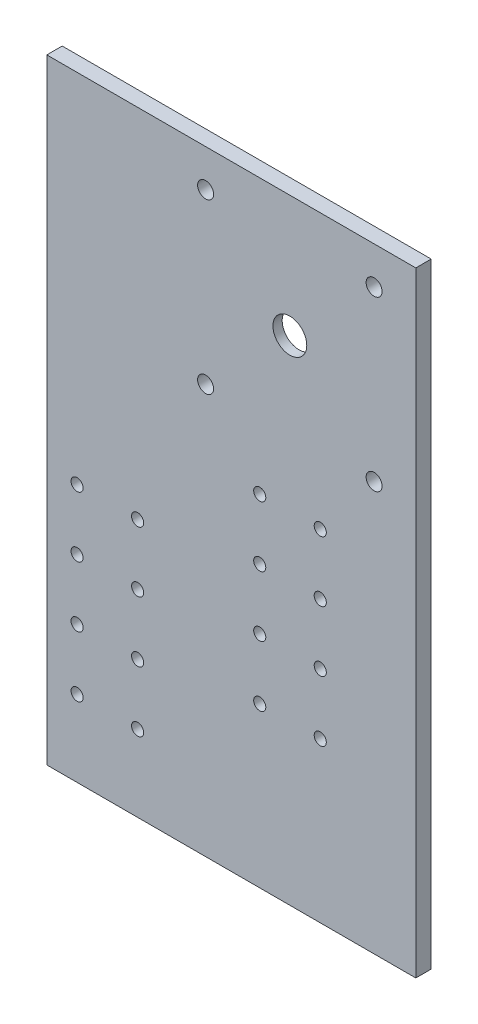
from build123d import *

# Parameters (mm, degrees)
SKETCH1_W           = 152.4
SKETCH1_H           = 254
BOSS_EXTRUDE1_DEPTH = 6.35
CUT_EXTRUDE1_REACH  = 150.242
SKETCH2_R           = 3.302
CUT_EXTRUDE2_REACH  = 150.242
SKETCH3_R           = 2.5
SKETCH4_R           = 36.5125
CUT_EXTRUDE3_DEPTH  = 2.54
CUT_EXTRUDE4_REACH  = 150.242
SKETCH6_R           = 6.985


with BuildPart() as part:
    # Sketch1 → Boss-Extrude1 (new body)
    with BuildSketch(Plane.XY):
        Rectangle(SKETCH1_W, SKETCH1_H)
    extrude(amount=BOSS_EXTRUDE1_DEPTH)

    # Sketch2 → Cut-Extrude1 (cut, up to next)
    with BuildSketch(Plane.XY.offset(6.35), mode=Mode.PRIVATE) as cut_extrude1_sk1:
        with Locations((58.978992443, 111.560894882)):
            Circle(SKETCH2_R)
    cut_extrude1_tool1 = extrude(cut_extrude1_sk1.sketch, amount=-CUT_EXTRUDE1_REACH, mode=Mode.PRIVATE) & part.part
    # Sketch2 → Cut-Extrude1 (cut, up to next)
    with BuildSketch(Plane.XY.offset(6.35), mode=Mode.PRIVATE) as cut_extrude1_sk2:
        with Locations((-10.617007564, 111.560894882)):
            Circle(SKETCH2_R)
    cut_extrude1_tool2 = extrude(cut_extrude1_sk2.sketch, amount=-CUT_EXTRUDE1_REACH, mode=Mode.PRIVATE) & part.part
    # Sketch2 → Cut-Extrude1 (cut, up to next)
    with BuildSketch(Plane.XY.offset(6.35), mode=Mode.PRIVATE) as cut_extrude1_sk3:
        with Locations((58.979977353, 41.964894882)):
            Circle(SKETCH2_R)
    cut_extrude1_tool3 = extrude(cut_extrude1_sk3.sketch, amount=-CUT_EXTRUDE1_REACH, mode=Mode.PRIVATE) & part.part
    # Sketch2 → Cut-Extrude1 (cut, up to next)
    with BuildSketch(Plane.XY.offset(6.35), mode=Mode.PRIVATE) as cut_extrude1_sk4:
        with Locations((-10.617992519, 41.963909921)):
            Circle(SKETCH2_R)
    cut_extrude1_tool4 = extrude(cut_extrude1_sk4.sketch, amount=-CUT_EXTRUDE1_REACH, mode=Mode.PRIVATE) & part.part
    add(cut_extrude1_tool1.solids().sort_by_distance((58.978992, 111.560895, 6.35))[0], mode=Mode.SUBTRACT)
    add(cut_extrude1_tool2.solids().sort_by_distance((-10.617008, 111.560895, 6.35))[0], mode=Mode.SUBTRACT)
    add(cut_extrude1_tool3.solids().sort_by_distance((58.979977, 41.964895, 6.35))[0], mode=Mode.SUBTRACT)
    add(cut_extrude1_tool4.solids().sort_by_distance((-10.617993, 41.96391, 6.35))[0], mode=Mode.SUBTRACT)

    # Sketch3 → Cut-Extrude2 (cut, up to next)
    with BuildSketch(Plane(origin=(0, 0, 0), x_dir=(-1, 0, 0), z_dir=(0, 0, -1)), mode=Mode.PRIVATE) as cut_extrude2_sk1:
        with Locations((63.7, -20.45)):
            Circle(SKETCH3_R)
    cut_extrude2_tool1 = extrude(cut_extrude2_sk1.sketch, amount=-CUT_EXTRUDE2_REACH, mode=Mode.PRIVATE) & part.part
    # Sketch3 → Cut-Extrude2 (cut, up to next)
    with BuildSketch(Plane(origin=(0, 0, 0), x_dir=(-1, 0, 0), z_dir=(0, 0, -1)), mode=Mode.PRIVATE) as cut_extrude2_sk2:
        with Locations((38.7, -20.45)):
            Circle(SKETCH3_R)
    cut_extrude2_tool2 = extrude(cut_extrude2_sk2.sketch, amount=-CUT_EXTRUDE2_REACH, mode=Mode.PRIVATE) & part.part
    # Sketch3 → Cut-Extrude2 (cut, up to next)
    with BuildSketch(Plane(origin=(0, 0, 0), x_dir=(-1, 0, 0), z_dir=(0, 0, -1)), mode=Mode.PRIVATE) as cut_extrude2_sk3:
        with Locations((38.7, -45.45)):
            Circle(SKETCH3_R)
    cut_extrude2_tool3 = extrude(cut_extrude2_sk3.sketch, amount=-CUT_EXTRUDE2_REACH, mode=Mode.PRIVATE) & part.part
    # Sketch3 → Cut-Extrude2 (cut, up to next)
    with BuildSketch(Plane(origin=(0, 0, 0), x_dir=(-1, 0, 0), z_dir=(0, 0, -1)), mode=Mode.PRIVATE) as cut_extrude2_sk4:
        with Locations((63.7, -45.45)):
            Circle(SKETCH3_R)
    cut_extrude2_tool4 = extrude(cut_extrude2_sk4.sketch, amount=-CUT_EXTRUDE2_REACH, mode=Mode.PRIVATE) & part.part
    # Sketch3 → Cut-Extrude2 (cut, up to next)
    with BuildSketch(Plane(origin=(0, 0, 0), x_dir=(-1, 0, 0), z_dir=(0, 0, -1)), mode=Mode.PRIVATE) as cut_extrude2_sk5:
        with Locations((63.7, -70.45)):
            Circle(SKETCH3_R)
    cut_extrude2_tool5 = extrude(cut_extrude2_sk5.sketch, amount=-CUT_EXTRUDE2_REACH, mode=Mode.PRIVATE) & part.part
    # Sketch3 → Cut-Extrude2 (cut, up to next)
    with BuildSketch(Plane(origin=(0, 0, 0), x_dir=(-1, 0, 0), z_dir=(0, 0, -1)), mode=Mode.PRIVATE) as cut_extrude2_sk6:
        with Locations((38.7, -70.45)):
            Circle(SKETCH3_R)
    cut_extrude2_tool6 = extrude(cut_extrude2_sk6.sketch, amount=-CUT_EXTRUDE2_REACH, mode=Mode.PRIVATE) & part.part
    # Sketch3 → Cut-Extrude2 (cut, up to next)
    with BuildSketch(Plane(origin=(0, 0, 0), x_dir=(-1, 0, 0), z_dir=(0, 0, -1)), mode=Mode.PRIVATE) as cut_extrude2_sk7:
        with Locations((38.7, -95.45)):
            Circle(SKETCH3_R)
    cut_extrude2_tool7 = extrude(cut_extrude2_sk7.sketch, amount=-CUT_EXTRUDE2_REACH, mode=Mode.PRIVATE) & part.part
    # Sketch3 → Cut-Extrude2 (cut, up to next)
    with BuildSketch(Plane(origin=(0, 0, 0), x_dir=(-1, 0, 0), z_dir=(0, 0, -1)), mode=Mode.PRIVATE) as cut_extrude2_sk8:
        with Locations((63.7, -95.45)):
            Circle(SKETCH3_R)
    cut_extrude2_tool8 = extrude(cut_extrude2_sk8.sketch, amount=-CUT_EXTRUDE2_REACH, mode=Mode.PRIVATE) & part.part
    # Sketch3 → Cut-Extrude2 (cut, up to next)
    with BuildSketch(Plane(origin=(0, 0, 0), x_dir=(-1, 0, 0), z_dir=(0, 0, -1)), mode=Mode.PRIVATE) as cut_extrude2_sk9:
        with Locations((-11.738, -61.16)):
            Circle(SKETCH3_R)
    cut_extrude2_tool9 = extrude(cut_extrude2_sk9.sketch, amount=-CUT_EXTRUDE2_REACH, mode=Mode.PRIVATE) & part.part
    # Sketch3 → Cut-Extrude2 (cut, up to next)
    with BuildSketch(Plane(origin=(0, 0, 0), x_dir=(-1, 0, 0), z_dir=(0, 0, -1)), mode=Mode.PRIVATE) as cut_extrude2_sk10:
        with Locations((-11.738, -36.16)):
            Circle(SKETCH3_R)
    cut_extrude2_tool10 = extrude(cut_extrude2_sk10.sketch, amount=-CUT_EXTRUDE2_REACH, mode=Mode.PRIVATE) & part.part
    # Sketch3 → Cut-Extrude2 (cut, up to next)
    with BuildSketch(Plane(origin=(0, 0, 0), x_dir=(-1, 0, 0), z_dir=(0, 0, -1)), mode=Mode.PRIVATE) as cut_extrude2_sk11:
        with Locations((-36.738, -61.16)):
            Circle(SKETCH3_R)
    cut_extrude2_tool11 = extrude(cut_extrude2_sk11.sketch, amount=-CUT_EXTRUDE2_REACH, mode=Mode.PRIVATE) & part.part
    # Sketch3 → Cut-Extrude2 (cut, up to next)
    with BuildSketch(Plane(origin=(0, 0, 0), x_dir=(-1, 0, 0), z_dir=(0, 0, -1)), mode=Mode.PRIVATE) as cut_extrude2_sk12:
        with Locations((-36.738, -36.16)):
            Circle(SKETCH3_R)
    cut_extrude2_tool12 = extrude(cut_extrude2_sk12.sketch, amount=-CUT_EXTRUDE2_REACH, mode=Mode.PRIVATE) & part.part
    # Sketch3 → Cut-Extrude2 (cut, up to next)
    with BuildSketch(Plane(origin=(0, 0, 0), x_dir=(-1, 0, 0), z_dir=(0, 0, -1)), mode=Mode.PRIVATE) as cut_extrude2_sk13:
        with Locations((-11.738, -11.16)):
            Circle(SKETCH3_R)
    cut_extrude2_tool13 = extrude(cut_extrude2_sk13.sketch, amount=-CUT_EXTRUDE2_REACH, mode=Mode.PRIVATE) & part.part
    # Sketch3 → Cut-Extrude2 (cut, up to next)
    with BuildSketch(Plane(origin=(0, 0, 0), x_dir=(-1, 0, 0), z_dir=(0, 0, -1)), mode=Mode.PRIVATE) as cut_extrude2_sk14:
        with Locations((-36.738, -11.16)):
            Circle(SKETCH3_R)
    cut_extrude2_tool14 = extrude(cut_extrude2_sk14.sketch, amount=-CUT_EXTRUDE2_REACH, mode=Mode.PRIVATE) & part.part
    # Sketch3 → Cut-Extrude2 (cut, up to next)
    with BuildSketch(Plane(origin=(0, 0, 0), x_dir=(-1, 0, 0), z_dir=(0, 0, -1)), mode=Mode.PRIVATE) as cut_extrude2_sk15:
        with Locations((-36.738, 13.84)):
            Circle(SKETCH3_R)
    cut_extrude2_tool15 = extrude(cut_extrude2_sk15.sketch, amount=-CUT_EXTRUDE2_REACH, mode=Mode.PRIVATE) & part.part
    # Sketch3 → Cut-Extrude2 (cut, up to next)
    with BuildSketch(Plane(origin=(0, 0, 0), x_dir=(-1, 0, 0), z_dir=(0, 0, -1)), mode=Mode.PRIVATE) as cut_extrude2_sk16:
        with Locations((-11.738, 13.84)):
            Circle(SKETCH3_R)
    cut_extrude2_tool16 = extrude(cut_extrude2_sk16.sketch, amount=-CUT_EXTRUDE2_REACH, mode=Mode.PRIVATE) & part.part
    add(cut_extrude2_tool1.solids().sort_by_distance((-63.7, -20.45, 0))[0], mode=Mode.SUBTRACT)
    add(cut_extrude2_tool2.solids().sort_by_distance((-38.7, -20.45, 0))[0], mode=Mode.SUBTRACT)
    add(cut_extrude2_tool3.solids().sort_by_distance((-38.7, -45.45, 0))[0], mode=Mode.SUBTRACT)
    add(cut_extrude2_tool4.solids().sort_by_distance((-63.7, -45.45, 0))[0], mode=Mode.SUBTRACT)
    add(cut_extrude2_tool5.solids().sort_by_distance((-63.7, -70.45, 0))[0], mode=Mode.SUBTRACT)
    add(cut_extrude2_tool6.solids().sort_by_distance((-38.7, -70.45, 0))[0], mode=Mode.SUBTRACT)
    add(cut_extrude2_tool7.solids().sort_by_distance((-38.7, -95.45, 0))[0], mode=Mode.SUBTRACT)
    add(cut_extrude2_tool8.solids().sort_by_distance((-63.7, -95.45, 0))[0], mode=Mode.SUBTRACT)
    add(cut_extrude2_tool9.solids().sort_by_distance((11.738, -61.16, 0))[0], mode=Mode.SUBTRACT)
    add(cut_extrude2_tool10.solids().sort_by_distance((11.738, -36.16, 0))[0], mode=Mode.SUBTRACT)
    add(cut_extrude2_tool11.solids().sort_by_distance((36.738, -61.16, 0))[0], mode=Mode.SUBTRACT)
    add(cut_extrude2_tool12.solids().sort_by_distance((36.738, -36.16, 0))[0], mode=Mode.SUBTRACT)
    add(cut_extrude2_tool13.solids().sort_by_distance((11.738, -11.16, 0))[0], mode=Mode.SUBTRACT)
    add(cut_extrude2_tool14.solids().sort_by_distance((36.738, -11.16, 0))[0], mode=Mode.SUBTRACT)
    add(cut_extrude2_tool15.solids().sort_by_distance((36.738, 13.84, 0))[0], mode=Mode.SUBTRACT)
    add(cut_extrude2_tool16.solids().sort_by_distance((11.738, 13.84, 0))[0], mode=Mode.SUBTRACT)

    # Sketch4 → Cut-Extrude3 (cut)
    with BuildSketch(Plane(origin=(0, 0, 0), x_dir=(-1, 0, 0), z_dir=(0, 0, -1))):
        with Locations((-24.180499962, 76.762402402)):
            Circle(SKETCH4_R)
    extrude(amount=-CUT_EXTRUDE3_DEPTH, mode=Mode.SUBTRACT)

    # Sketch6 → Cut-Extrude4 (cut, up to next)
    with BuildSketch(Plane.XY.offset(6.35), mode=Mode.PRIVATE) as cut_extrude4_sk1:
        with Locations((24.180499962, 76.762402402)):
            Circle(SKETCH6_R)
    cut_extrude4_tool1 = extrude(cut_extrude4_sk1.sketch, amount=-CUT_EXTRUDE4_REACH, mode=Mode.PRIVATE) & part.part
    add(cut_extrude4_tool1.solids().sort_by_distance((24.1805, 76.762402, 6.35))[0], mode=Mode.SUBTRACT)


solid = part.part
